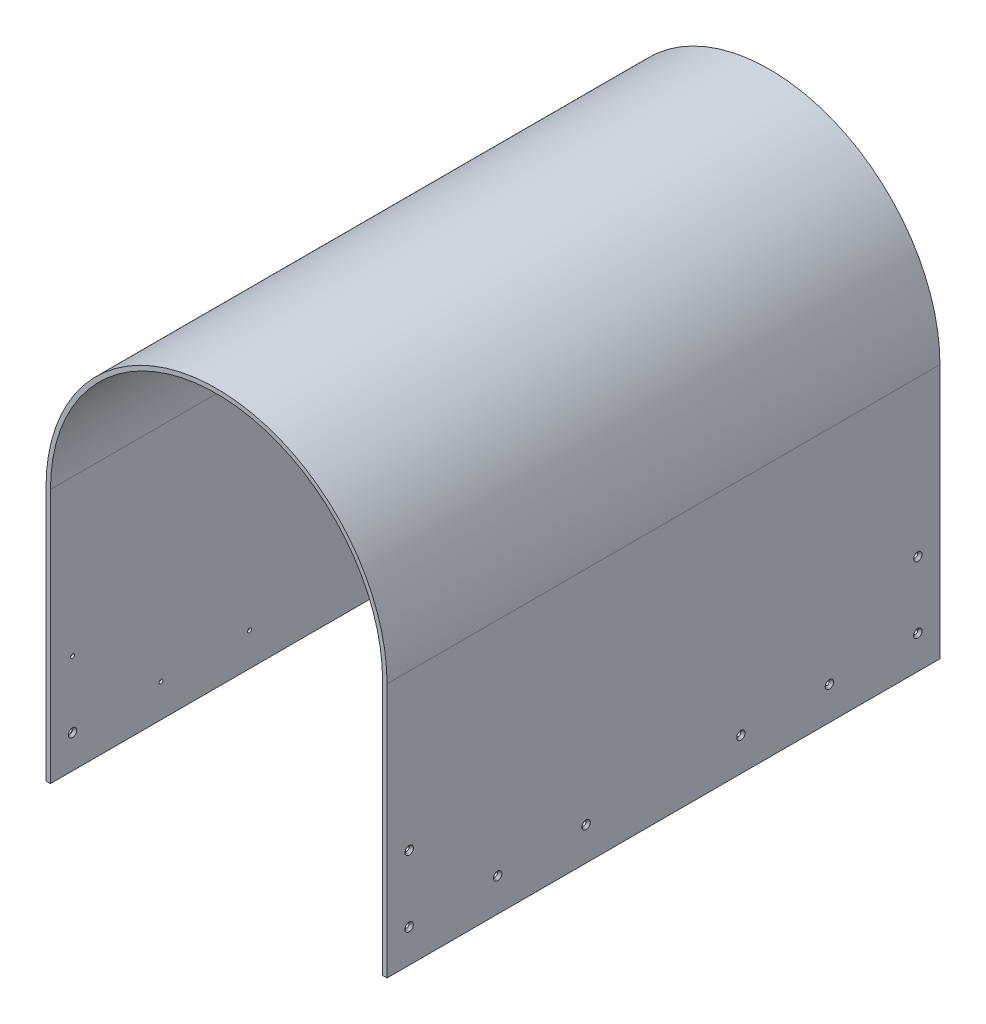
from build123d import *

# Parameters (mm, degrees)
BOSS_EXTRUDE1_DEPTH = 125
SKETCH3_R           = 0.9
CUT_EXTRUDE1_DEPTH  = 277.372809806
CHAMFER1_SIZE       = 1
CHAMFER2_SIZE       = 1
CUT_EXTRUDE2_REACH  = 278.373
SKETCH4_W           = 18
SKETCH4_H           = 14


with BuildPart() as part:
    # Sketch1 → Boss-Extrude1 (new, symmetric)
    with BuildSketch(Plane.XY):
        with BuildLine():
            Line((-75.1, 0), (-75.1, 115.2))
            ThreePointArc((-75.1, 115.2), (0, 190.3), (75.1, 115.2))
            Line((75.1, 115.2), (75.1, 0))
            Line((75.1, 0), (77.1, 0))
            Line((77.1, 0), (77.1, 115.2))
            ThreePointArc((77.1, 115.2), (0, 192.3), (-77.1, 115.2))
            Line((-77.1, 115.2), (-77.1, 0))
            Line((-77.1, 0), (-75.1, 0))
        make_face()
    extrude(amount=BOSS_EXTRUDE1_DEPTH, both=True)

    # Sketch3 → Cut-Extrude1 (cut, through all)
    with BuildSketch(Plane.ZY.offset(77.1)):
        with Locations((-115, 15)):
            Circle(SKETCH3_R)
        with Locations((-75, 15)):
            Circle(SKETCH3_R)
        with Locations((-35, 15)):
            Circle(SKETCH3_R)
        with Locations((-115, 45)):
            Circle(SKETCH3_R)
    cut_extrude1 = extrude(amount=-CUT_EXTRUDE1_DEPTH, mode=Mode.SUBTRACT)

    # Mirror1: Cut-Extrude1 across plane
    add(cut_extrude1.mirror(Plane.XY), mode=Mode.SUBTRACT)

    # Chamfer1
    chamfer1_edges = [part.edges().sort_by_distance(p)[0] for p in [
        (-77.1, 45, -115.9),
        (-77.1, 15, -35.9),
        (-77.1, 15, -75.9),
        (-77.1, 15, -115.9),
        (-77.1, 45, 115.9),
        (-77.1, 15, 35.9),
        (-77.1, 15, 75.9),
        (-77.1, 15, 115.9),
        (-75.1, 15, 115.9),
    ]]
    chamfer(chamfer1_edges, length=CHAMFER1_SIZE - 0.0001)  # a hair under: the kernel refuses the full size

    # Chamfer2
    chamfer2_edges = [part.edges().sort_by_distance(p)[0] for p in [
        (77.1, 45, -115.9),
        (77.1, 15, -35.9),
        (77.1, 15, -75.9),
        (77.1, 15, -115.9),
        (77.1, 45, 115.9),
        (77.1, 15, 35.9),
        (77.1, 15, 75.9),
        (77.1, 15, 115.9),
    ]]
    chamfer(chamfer2_edges, length=CHAMFER2_SIZE)

    # Sketch4 → Cut-Extrude2 (cut, up to next)
    with BuildSketch(Plane.ZY.offset(77.1), mode=Mode.PRIVATE) as cut_extrude2_sk1:
        with Locations((-20, 77)):
            Rectangle(SKETCH4_W, SKETCH4_H)
    cut_extrude2_tool1 = extrude(cut_extrude2_sk1.sketch, amount=-CUT_EXTRUDE2_REACH, mode=Mode.PRIVATE) & part.part
    add(cut_extrude2_tool1.solids().sort_by_distance((-77.1, 77, -20))[0], mode=Mode.SUBTRACT)


solid = part.part
